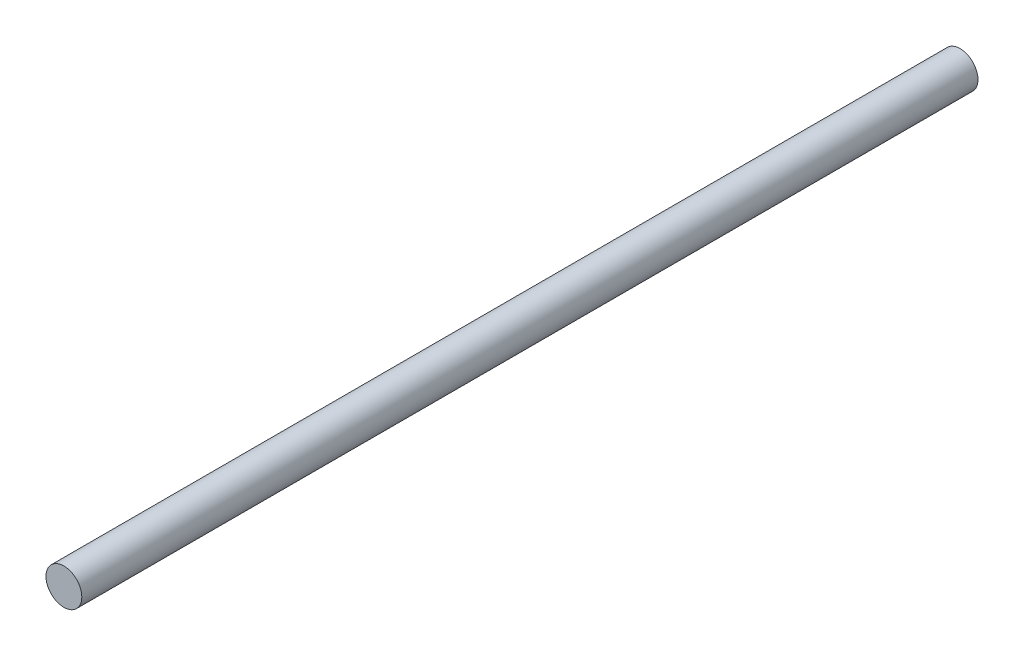
from build123d import *

# Parameters (mm, degrees)
BOSS_EXTRUDE1_DEPTH      = 100
BOSS_EXTRUDE1_DEPTH_BACK = 50
SKETCH1_R                = 3


with BuildPart() as part:
    # Sketch1 → Boss-Extrude1 (new, two sides: drawn at the far end of the back side and taken through both)
    with BuildSketch(Plane.XY.offset(-BOSS_EXTRUDE1_DEPTH_BACK)):
        Circle(SKETCH1_R)
    extrude(amount=BOSS_EXTRUDE1_DEPTH + BOSS_EXTRUDE1_DEPTH_BACK)


solid = part.part
